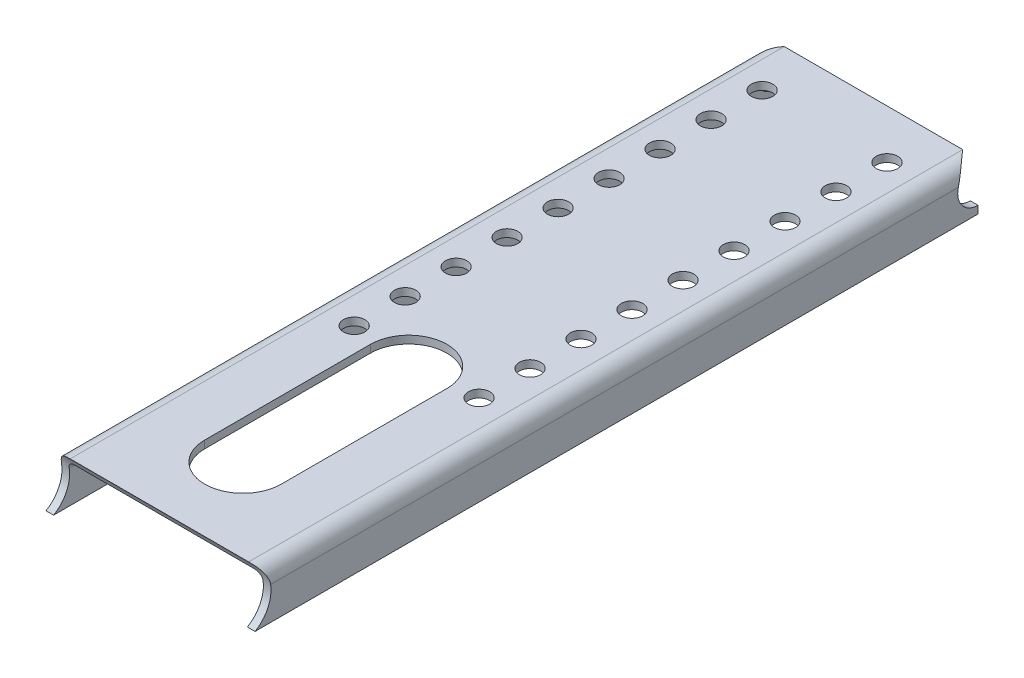
from build123d import *

# Parameters (mm, degrees)
SKETCH1_W                   = 70
SKETCH1_H                   = 290
BASE_FLANGE1_DEPTH          = 3
SM_EDGE_FLANGE_1_DEPTH      = 290
SM_EDGE_FLANGE_1_BEND_DEPTH = 290
INDENT1_START               = -127
INDENT1_DEPTH               = 84
INDENT1_START_2             = -123.729611107
INDENT1_2_DEPTH             = 77.459222009
INDENT1_3_DEPTH             = 0.729611107
INDENT1_START_3             = -47
INDENT1_4_DEPTH             = 0.729610902
INDENT1_START_4             = -50.0000001
INDENT1_5_DEPTH             = 6.0000001
INDENT1_START_5             = -126
INDENT1_6_DEPTH             = 6
INDENT1_START_6             = -290
INDENT1_7_DEPTH             = 6.65
INDENT2_START               = -127
INDENT2_DEPTH               = 84
INDENT2_START_2             = -11.0000001
INDENT2_2_DEPTH             = 11.0000001
INDENT2_START_3             = -126
INDENT2_3_DEPTH             = 82
CUT_EXTRUDE1_DEPTH          = 317.754179273
CUT_EXTRUDE1_DEPTH_BACK     = 317.754179273
SKETCH12_R                  = 4.2
CUT_EXTRUDE2_DEPTH          = 10


with BuildPart() as part:
    # Base-Flange1: sheet metal written as solids
    # Sketch1 → Base-Flange1 (new body)
    with BuildSketch(Plane(origin=(0, 207.95, 0), x_dir=(1, 0, 0), z_dir=(0, 1, 0))):
        with Locations((-85, 145)):
            Rectangle(SKETCH1_W, SKETCH1_H)
    extrude(amount=-BASE_FLANGE1_DEPTH)

    # 邊線-凸緣1: sheet metal written as solids
    # 邊線-凸緣1 section (on a plane across the edge) → 邊線-凸緣1 (add)
    with BuildSketch(Plane(origin=(-47, 204.95, -290), x_dir=(-1, 0, 0), z_dir=(0, 0, 1))):
        with BuildLine():
            Line((-3, 3), (-3, 15.9))
            Line((-3, 15.9), (0, 15.9))
            Line((0, 15.9), (0, 3))
            ThreePointArc((0, 3), (0.878679656, 0.878679656), (3, 0))
            Line((3, 0), (3, -3))
            ThreePointArc((3, -3), (-1.242640687, -1.242640687), (-3, 3))
        make_face()
    extrude(amount=SM_EDGE_FLANGE_1_DEPTH)

    # 邊線-凸緣1 section 2 (on a plane across the edge) → 邊線-凸緣1 bend (add)
    with BuildSketch(Plane(origin=(-123, 204.95, 0), x_dir=(1, 0, 0), z_dir=(0, 0, -1))):
        with BuildLine():
            Line((-3, 3), (-3, 15.9))
            Line((-3, 15.9), (0, 15.9))
            Line((0, 15.9), (0, 3))
            ThreePointArc((0, 3), (0.878679656, 0.878679656), (3, 0))
            Line((3, 0), (3, -3))
            ThreePointArc((3, -3), (-1.242640687, -1.242640687), (-3, 3))
        make_face()
    extrude(amount=SM_EDGE_FLANGE_1_BEND_DEPTH)

    # Indent1: read off the stored shape, not the designer's step
    # Indent1 outline → Indent1 (cut)
    with BuildSketch(Plane.YZ.offset(INDENT1_START)):
        with BuildLine():
            Line((192.05, -290), (207.95, -290))
            ThreePointArc((207.95, -290), (200, -282.05), (192.05, -290))
        make_face()
    extrude(amount=INDENT1_DEPTH, mode=Mode.SUBTRACT)

    # Indent2: read off the stored shape, not the designer's step
    # Indent2 outline → Indent2 (cut)
    with BuildSketch(Plane.YZ.offset(INDENT2_START)):
        with BuildLine():
            ThreePointArc((189.05, -6.433311744), (197.7062633, -12.491147744), (207.950014124, -9.903902031))
            Line((207.950014124, -9.903902031), (209, -9.061062257))
            Line((209, -9.061062257), (209, 1))
            Line((209, 1), (188, 1))
            Line((188, 1), (188, 0))
            Line((188, 0), (188, -4.64612958))
            Line((188, -4.64612958), (189.05, -6.433311744))
        make_face()
    extrude(amount=INDENT2_DEPTH, mode=Mode.SUBTRACT)

    # Sketch12 → Cut-Extrude1 (cut, two sides: drawn at the far end of the back side and taken through both)
    with BuildSketch(Plane(origin=(0, 207.95, 0), x_dir=(1, 0, 0), z_dir=(0, 1, 0)).offset(-CUT_EXTRUDE1_DEPTH_BACK)):
        with Locations((-109.5, 270.8)):
            Circle(SKETCH12_R)
        with Locations((-60.5, 270.8)):
            Circle(SKETCH12_R)
        with Locations((-60.5, 250.8)):
            Circle(SKETCH12_R)
        with Locations((-109.5, 250.8)):
            Circle(SKETCH12_R)
        with Locations((-60.5, 230.8)):
            Circle(SKETCH12_R)
        with Locations((-109.5, 230.8)):
            Circle(SKETCH12_R)
        with Locations((-60.5, 210.8)):
            Circle(SKETCH12_R)
        with Locations((-109.5, 210.8)):
            Circle(SKETCH12_R)
        with Locations((-60.5, 190.8)):
            Circle(SKETCH12_R)
        with Locations((-109.5, 190.8)):
            Circle(SKETCH12_R)
        with Locations((-60.5, 170.8)):
            Circle(SKETCH12_R)
        with Locations((-109.5, 170.8)):
            Circle(SKETCH12_R)
        with Locations((-60.5, 150.8)):
            Circle(SKETCH12_R)
        with Locations((-109.5, 150.8)):
            Circle(SKETCH12_R)
        with Locations((-60.5, 130.8)):
            Circle(SKETCH12_R)
        with Locations((-109.5, 130.8)):
            Circle(SKETCH12_R)
        with Locations((-60.5, 110.8)):
            Circle(SKETCH12_R)
        with Locations((-109.5, 110.8)):
            Circle(SKETCH12_R)
    extrude(amount=CUT_EXTRUDE1_DEPTH + CUT_EXTRUDE1_DEPTH_BACK, mode=Mode.SUBTRACT)

    # Sketch13 → Cut-Extrude2 (cut)
    with BuildSketch(Plane(origin=(0, 207.95, 0), x_dir=(1, 0, 0), z_dir=(0, 1, 0))):
        with BuildLine():
            Line((-70, 107.7), (-70, 42.7))
            ThreePointArc((-70, 42.7), (-85, 27.7), (-100, 42.7))
            Line((-100, 42.7), (-100, 107.7))
            ThreePointArc((-100, 107.7), (-85, 122.7), (-70, 107.7))
        make_face()
    extrude(amount=-CUT_EXTRUDE2_DEPTH, mode=Mode.SUBTRACT)


with BuildPart() as body_2:
    # Indent1 2 outline → Indent1 2 (new body)
    with BuildSketch(Plane.YZ.offset(INDENT1_START_2)):
        with BuildLine():
            Line((204.95, -285.559279338), (204.95, -290))
            Line((204.95, -290), (206.65, -290))
            ThreePointArc((206.65, -290), (206.210475022, -287.622501314), (204.95, -285.559279338))
        make_face()
    extrude(amount=INDENT1_2_DEPTH)

    # Indent1 3 outline → Indent1 3 (add)
    with BuildSketch(Plane.YZ.offset(INDENT1_START_2)):
        with BuildLine():
            Line((193.35, -290), (204.95, -290))
            Line((204.95, -290), (204.95, -285.559279338))
            ThreePointArc((204.95, -285.559279338), (197.622501314, -283.789524978), (193.35, -290))
        make_face()
    extrude(amount=INDENT1_3_DEPTH)

    # Indent1 4 outline → Indent1 4 (add)
    with BuildSketch(Plane.YZ.offset(INDENT1_START_3)):
        with BuildLine():
            Line((193.35, -290), (204.95, -290))
            Line((204.95, -290), (204.95, -285.559279338))
            ThreePointArc((204.95, -285.559279338), (197.622501314, -283.789524978), (193.35, -290))
        make_face()
    extrude(amount=INDENT1_4_DEPTH)

    # Indent1 5 outline → Indent1 5 (add)
    with BuildSketch(Plane.YZ.offset(INDENT1_START_4)):
        with BuildLine():
            Line((193.35, -290), (206.65, -290))
            ThreePointArc((206.65, -290), (200, -283.35), (193.35, -290))
        make_face()
    extrude(amount=INDENT1_5_DEPTH)

    # Indent1 6 outline → Indent1 6 (add)
    with BuildSketch(Plane.YZ.offset(INDENT1_START_5)):
        with BuildLine():
            Line((193.35, -290), (206.65, -290))
            ThreePointArc((206.65, -290), (200, -283.35), (193.35, -290))
        make_face()
    extrude(amount=INDENT1_6_DEPTH)

    # Indent1 7 outline → Indent1 7 (cut)
    with BuildSketch(Plane.XY.offset(INDENT1_START_6)):
        with BuildLine():
            Line((-47, 192), (-47, 201.95))
            ThreePointArc((-47, 201.95), (-47.878679656, 204.071320344), (-50, 204.95))
            Line((-50, 204.95), (-50.0000001, 192))
            Line((-50.0000001, 192), (-47, 192))
        make_face()
        with BuildLine():
            Line((-123, 192), (-120, 192))
            Line((-120, 192), (-120, 204.95))
            ThreePointArc((-120, 204.95), (-122.121320344, 204.071320344), (-123, 201.95))
            Line((-123, 201.95), (-123, 192))
        make_face()
        with BuildLine():
            ThreePointArc((-46.270396534, 206.650006169), (-44.597333029, 204.559825589), (-44, 201.95))
            Line((-44, 201.95), (-44, 208))
            Line((-44, 208), (-47.971644239, 208))
            Line((-47.971644239, 208), (-46.270396534, 206.650006169))
        make_face()
        with BuildLine():
            Line((-126, 208), (-126, 201.95))
            ThreePointArc((-126, 201.95), (-125.402668364, 204.559822705), (-123.729608483, 206.650002187))
            Line((-123.729608483, 206.650002187), (-122.028359489, 208))
            Line((-122.028359489, 208), (-126, 208))
        make_face()
    extrude(amount=INDENT1_7_DEPTH, mode=Mode.SUBTRACT)


with BuildPart() as body_3:
    # Indent2 2 outline → Indent2 2 (new body)
    with BuildSketch(Plane.XY.offset(INDENT2_START_2)):
        with BuildLine():
            Line((-44, 189.05), (-44, 201.95))
            ThreePointArc((-44, 201.95), (-45.757359313, 206.192640687), (-50, 207.95))
            Line((-50, 207.95), (-120, 207.95))
            ThreePointArc((-120, 207.95), (-124.242640687, 206.192640687), (-126, 201.95))
            Line((-126, 201.95), (-126, 189.05))
            Line((-126, 189.05), (-123, 189.05))
            Line((-123, 189.05), (-123, 201.95))
            ThreePointArc((-123, 201.95), (-122.121320344, 204.071320344), (-120, 204.95))
            Line((-120, 204.95), (-50, 204.95))
            ThreePointArc((-50, 204.95), (-47.878679656, 204.071320344), (-47, 201.95))
            Line((-47, 201.95), (-47, 189.05))
            Line((-47, 189.05), (-44, 189.05))
        make_face()
    extrude(amount=INDENT2_2_DEPTH)

    # Indent2 3 outline → Indent2 3 (cut)
    with BuildSketch(Plane.YZ.offset(INDENT2_START_3)):
        with BuildLine():
            Line((207.95, -11.0000001), (207.950016725, -7.602449216))
            ThreePointArc((207.950016725, -7.602449216), (204.322791843, -10.115012145), (200.000000001, -11))
            Line((200.000000001, -11), (207.95, -11.0000001))
        make_face()
        with BuildLine():
            Line((189.05, -11.0000001), (200.000000001, -11))
            ThreePointArc((200.000000001, -11), (192.601479194, -8.140140655), (189.05, -1.047616342))
            Line((189.05, -1.047616342), (189.05, -11.0000001))
        make_face()
    extrude(amount=INDENT2_3_DEPTH, mode=Mode.SUBTRACT)


solid = part.part
